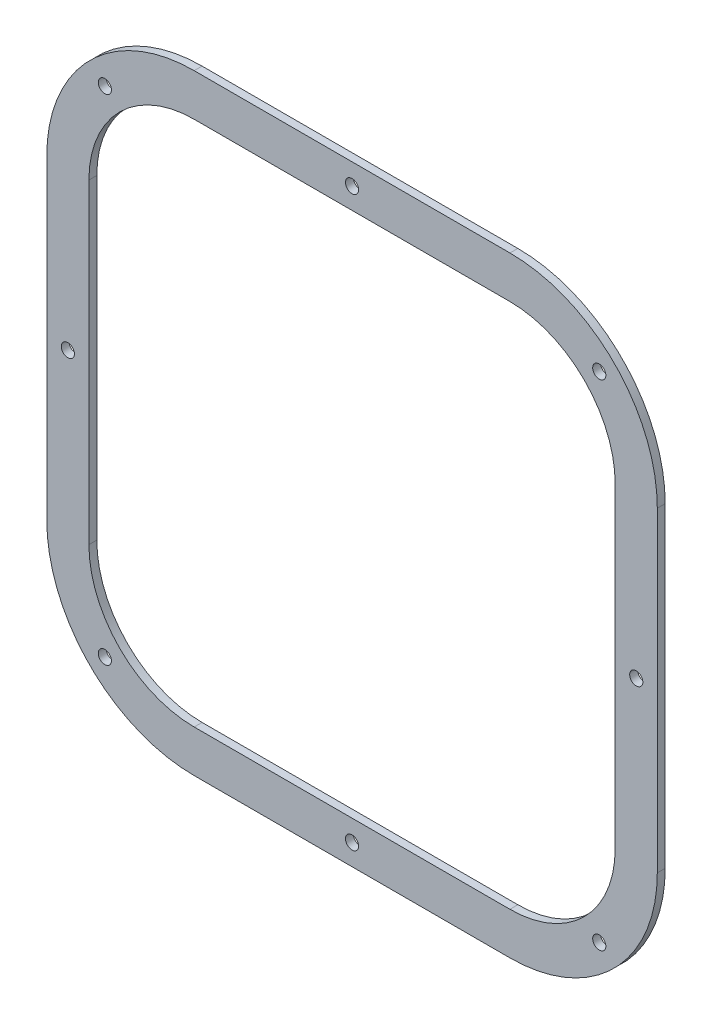
from build123d import *

# Parameters (mm, degrees)
CONVERT_SOLID1_START     = -1.5
CONVERT_SOLID1_OUTLINE_R = 1.25
CONVERT_SOLID1_DEPTH     = 1.5


# Read off the part's stored shape, not the designer's step: Convert-Solid1
with BuildPart() as part:
    # Convert-Solid1 outline → Convert-Solid1 (new body)
    with BuildSketch(Plane.XY.offset(CONVERT_SOLID1_START)):
        with BuildLine():
            Line((116, 28), (116, 88))
            ThreePointArc((116, 88), (107.798989873, 107.798989873), (88, 116))
            Line((88, 116), (28, 116))
            ThreePointArc((28, 116), (8.201010127, 107.798989873), (0, 88))
            Line((0, 88), (0, 28))
            ThreePointArc((0, 28), (8.201010127, 8.201010127), (28, 0))
            Line((28, 0), (88, 0))
            ThreePointArc((88, 0), (107.798989873, 8.201010127), (116, 28))
        make_face()
        with Locations((11.029437252, 11.029437252)):
            Circle(CONVERT_SOLID1_OUTLINE_R, mode=Mode.SUBTRACT)
        with Locations((58, 4)):
            Circle(CONVERT_SOLID1_OUTLINE_R, mode=Mode.SUBTRACT)
        with Locations((104.970562748, 11.029437252)):
            Circle(CONVERT_SOLID1_OUTLINE_R, mode=Mode.SUBTRACT)
        with Locations((4, 58)):
            Circle(CONVERT_SOLID1_OUTLINE_R, mode=Mode.SUBTRACT)
        with Locations((11.029437252, 104.970562748)):
            Circle(CONVERT_SOLID1_OUTLINE_R, mode=Mode.SUBTRACT)
        with BuildLine():
            ThreePointArc((108, 28), (102.142135624, 13.857864376), (88, 8))
            Line((88, 8), (28, 8))
            ThreePointArc((28, 8), (13.857864376, 13.857864376), (8, 28))
            Line((8, 28), (8, 88))
            ThreePointArc((8, 88), (13.857864376, 102.142135624), (28, 108))
            Line((28, 108), (88, 108))
            ThreePointArc((88, 108), (102.142135624, 102.142135624), (108, 88))
            Line((108, 88), (108, 28))
        make_face(mode=Mode.SUBTRACT)
        with Locations((112, 58)):
            Circle(CONVERT_SOLID1_OUTLINE_R, mode=Mode.SUBTRACT)
        with Locations((58, 112)):
            Circle(CONVERT_SOLID1_OUTLINE_R, mode=Mode.SUBTRACT)
        with Locations((104.970562748, 104.970562748)):
            Circle(CONVERT_SOLID1_OUTLINE_R, mode=Mode.SUBTRACT)
    extrude(amount=CONVERT_SOLID1_DEPTH)


solid = part.part
